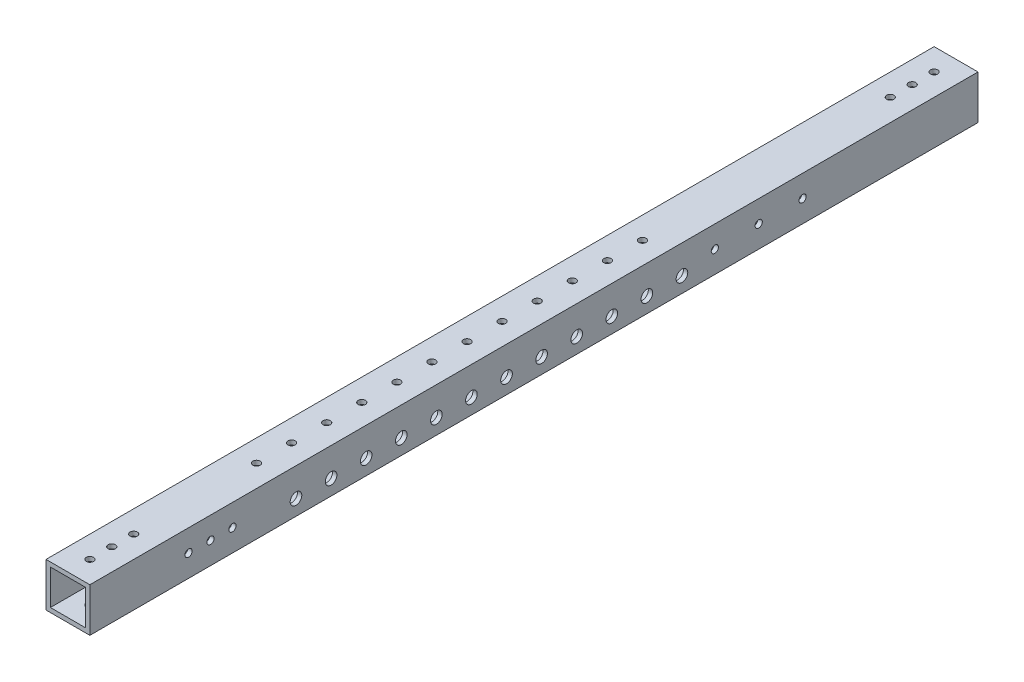
from build123d import *

# Parameters (mm, degrees)
SKETCH_1_W          = 20
SKETCH_1_H          = 20
SKETCH_1_W_2        = 16
SKETCH_1_H_2        = 16
EXTRUDE_1_DEPTH     = 405
SKETCH_2_R          = 1.65
CUT_EXTRUDE_1_DEPTH = 10
SKETCH_4_R          = 1.65
CUT_EXTRUDE_3_DEPTH = 10
SKETCH_10_R         = 1.65
SKETCH_10_R_2       = 2.65
CUT_EXTRUDE_4_DEPTH = 406.616814247
SKETCH_11_R         = 1.65
CUT_EXTRUDE_5_DEPTH = 406.616814247


with BuildPart() as part:
    # 草图1 → 凸台-拉伸1 (new body)
    with BuildSketch(Plane.XY):
        Rectangle(SKETCH_1_W, SKETCH_1_H)
        Rectangle(SKETCH_1_W_2, SKETCH_1_H_2, mode=Mode.SUBTRACT)
    extrude(amount=EXTRUDE_1_DEPTH)

    # 草图2 → 切除-拉伸1 (cut, symmetric)
    with BuildSketch(Plane(origin=(0, 0, 0), x_dir=(1, 0, 0), z_dir=(0, 1, 0))):
        with Locations((0, -395)):
            Circle(SKETCH_2_R)
        with Locations((0, -385)):
            Circle(SKETCH_2_R)
        with Locations((0, -375)):
            Circle(SKETCH_2_R)
    extrude(amount=CUT_EXTRUDE_1_DEPTH, both=True, mode=Mode.SUBTRACT)

    # 草图4 → 切除-拉伸3 (cut, symmetric)
    with BuildSketch(Plane(origin=(0, 0, 0), x_dir=(1, 0, 0), z_dir=(0, 1, 0))):
        with Locations((0, -10)):
            Circle(SKETCH_4_R)
        with Locations((0, -20)):
            Circle(SKETCH_4_R)
        with Locations((0, -30)):
            Circle(SKETCH_4_R)
    extrude(amount=CUT_EXTRUDE_3_DEPTH, both=True, mode=Mode.SUBTRACT)

    # 草图10 → 切除-拉伸4 (cut, through all)
    with BuildSketch(Plane(origin=(10, 0, 0), x_dir=(0, 0, -1), z_dir=(1, 0, 0))):
        with Locations((-120, 0)):
            Circle(SKETCH_10_R)
        with Locations((-100, 0)):
            Circle(SKETCH_10_R)
        with Locations((-80, 0)):
            Circle(SKETCH_10_R)
        with Locations((-135, -3)):
            Circle(SKETCH_10_R_2)
        with Locations((-151, -3)):
            Circle(SKETCH_10_R_2)
        with Locations((-167, -3)):
            Circle(SKETCH_10_R_2)
        with Locations((-183, -3)):
            Circle(SKETCH_10_R_2)
        with Locations((-199, -3)):
            Circle(SKETCH_10_R_2)
        with Locations((-215, -3)):
            Circle(SKETCH_10_R_2)
        with Locations((-231, -3)):
            Circle(SKETCH_10_R_2)
        with Locations((-247, -3)):
            Circle(SKETCH_10_R_2)
        with Locations((-263, -3)):
            Circle(SKETCH_10_R_2)
        with Locations((-279, -3)):
            Circle(SKETCH_10_R_2)
        with Locations((-295, -3)):
            Circle(SKETCH_10_R_2)
        with Locations((-311, -3)):
            Circle(SKETCH_10_R_2)
        with Locations((-360, 0)):
            Circle(SKETCH_10_R)
        with Locations((-350, 0)):
            Circle(SKETCH_10_R)
        with Locations((-340, 0)):
            Circle(SKETCH_10_R)
    extrude(amount=-CUT_EXTRUDE_4_DEPTH, mode=Mode.SUBTRACT)

    # 草图11 → 切除-拉伸5 (cut, through all)
    with BuildSketch(Plane(origin=(0, 10, 0), x_dir=(1, 0, 0), z_dir=(0, 1, 0))):
        with Locations((0, -143)):
            Circle(SKETCH_11_R)
        with Locations((0, -159)):
            Circle(SKETCH_11_R)
        with Locations((0, -175)):
            Circle(SKETCH_11_R)
        with Locations((0, -191)):
            Circle(SKETCH_11_R)
        with Locations((0, -207)):
            Circle(SKETCH_11_R)
        with Locations((0, -223)):
            Circle(SKETCH_11_R)
        with Locations((0, -239)):
            Circle(SKETCH_11_R)
        with Locations((0, -255)):
            Circle(SKETCH_11_R)
        with Locations((0, -271)):
            Circle(SKETCH_11_R)
        with Locations((0, -287)):
            Circle(SKETCH_11_R)
        with Locations((0, -303)):
            Circle(SKETCH_11_R)
        with Locations((0, -319)):
            Circle(SKETCH_11_R)
    extrude(amount=-CUT_EXTRUDE_5_DEPTH, mode=Mode.SUBTRACT)


solid = part.part
